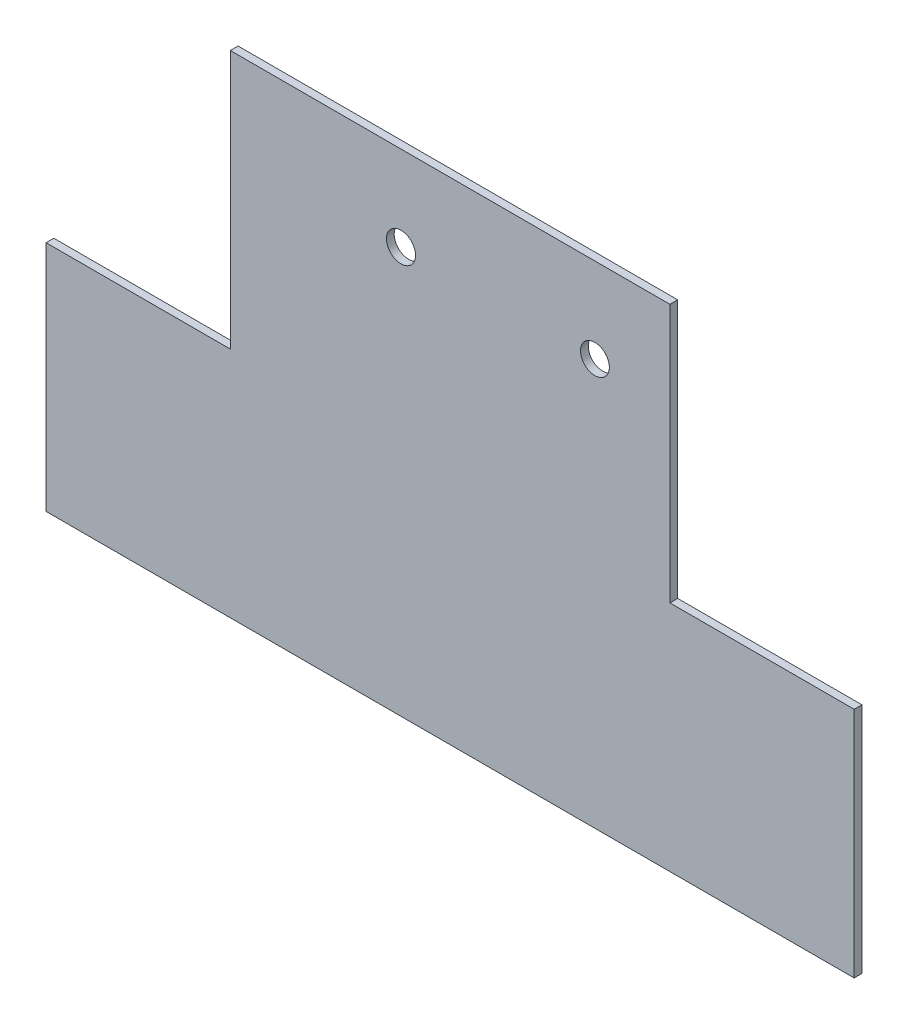
from build123d import *

# Parameters (mm, degrees)
SKETCH_1_R             = 2.25
SKETCH_1_R_2           = 2.227348473
SM_BASE_FLANGE_1_DEPTH = 1.2


# Sheet-metal steps are written as plain solids
with BuildPart() as part:
    # Sketch 1 → Базовая кромка1 (new body)
    with BuildSketch(Plane.XY):
        Polygon((28.5, 36), (28.5, 76), (96.5, 76), (96.5, 36), (125, 36), (125, 0), (0, 0), (0, 36), align=None)
        with Locations((54.9, 62.87)):
            Circle(SKETCH_1_R, mode=Mode.SUBTRACT)
        with Locations((84.9, 62.87)):
            Circle(SKETCH_1_R_2, mode=Mode.SUBTRACT)
    extrude(amount=-SM_BASE_FLANGE_1_DEPTH)


solid = part.part
